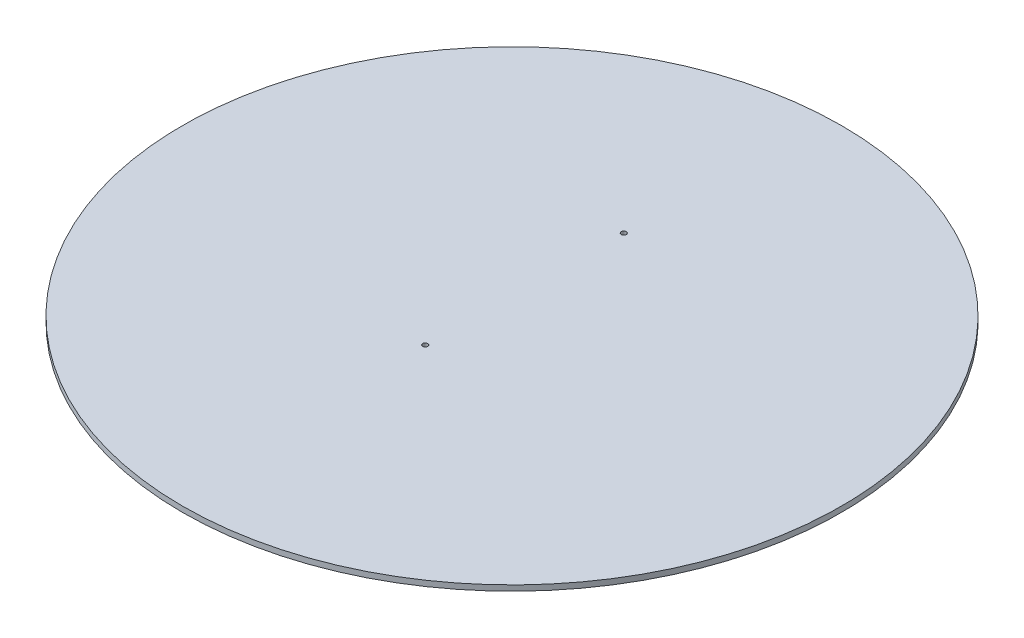
from build123d import *

# Parameters (mm, degrees)
SKETCH2_R           = 304.8
BOSS_EXTRUDE1_DEPTH = 5.08
SKETCH3_R           = 2.3495
CUT_EXTRUDE1_DEPTH  = 551.048167687


with BuildPart() as part:
    # Sketch2 → Boss-Extrude1 (new body)
    with BuildSketch(Plane(origin=(0, 0, 0), x_dir=(1, 0, 0), z_dir=(0, 1, 0))):
        Circle(SKETCH2_R)
    extrude(amount=BOSS_EXTRUDE1_DEPTH)

    # Sketch3 → Cut-Extrude1 (cut, through all)
    with BuildSketch(Plane(origin=(-67.065090383, 76.056924859, -93.301350804), x_dir=(0.9941524009920281, -0.1079843831563281, -0.0006136742891854782), z_dir=(0.10794896477866957, 0.99364514955026, 0.031880052987017446))):
        with Locations((57.571552198, -158.822157642)):
            Circle(SKETCH3_R)
        with Locations((59.899836143, 22.51767094)):
            Circle(SKETCH3_R)
    extrude(amount=-CUT_EXTRUDE1_DEPTH, mode=Mode.SUBTRACT)


solid = part.part
